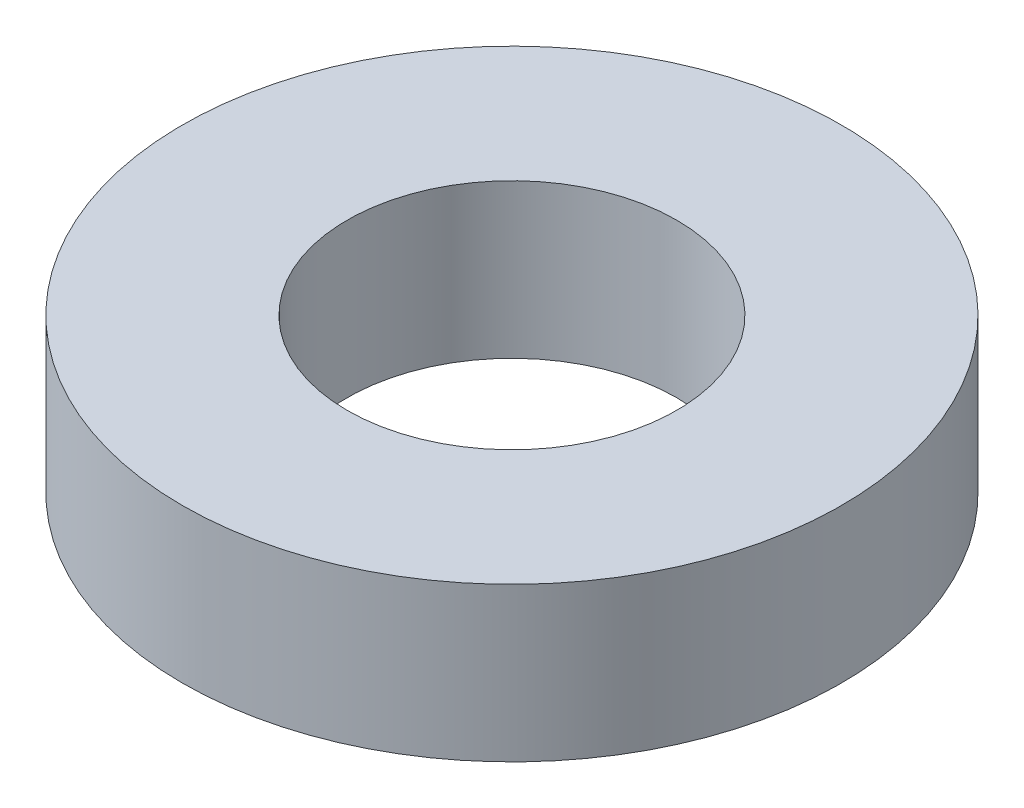
from build123d import *

# Parameters (mm, degrees)
SKETCH1_R           = 30
BOSS_EXTRUDE1_DEPTH = 14
SKETCH2_R           = 15
CUT_EXTRUDE1_DEPTH  = 45.676615807


with BuildPart() as part:
    # Sketch1 → Boss-Extrude1 (new body)
    with BuildSketch(Plane(origin=(0, 0, 0), x_dir=(1, 0, 0), z_dir=(0, 1, 0))):
        Circle(SKETCH1_R)
    extrude(amount=BOSS_EXTRUDE1_DEPTH)

    # Sketch2 → Cut-Extrude1 (cut, through all)
    with BuildSketch(Plane(origin=(0, 0, 0), x_dir=(1, 0, 0), z_dir=(0, 1, 0))):
        Circle(SKETCH2_R)
    extrude(amount=CUT_EXTRUDE1_DEPTH, mode=Mode.SUBTRACT)


solid = part.part
